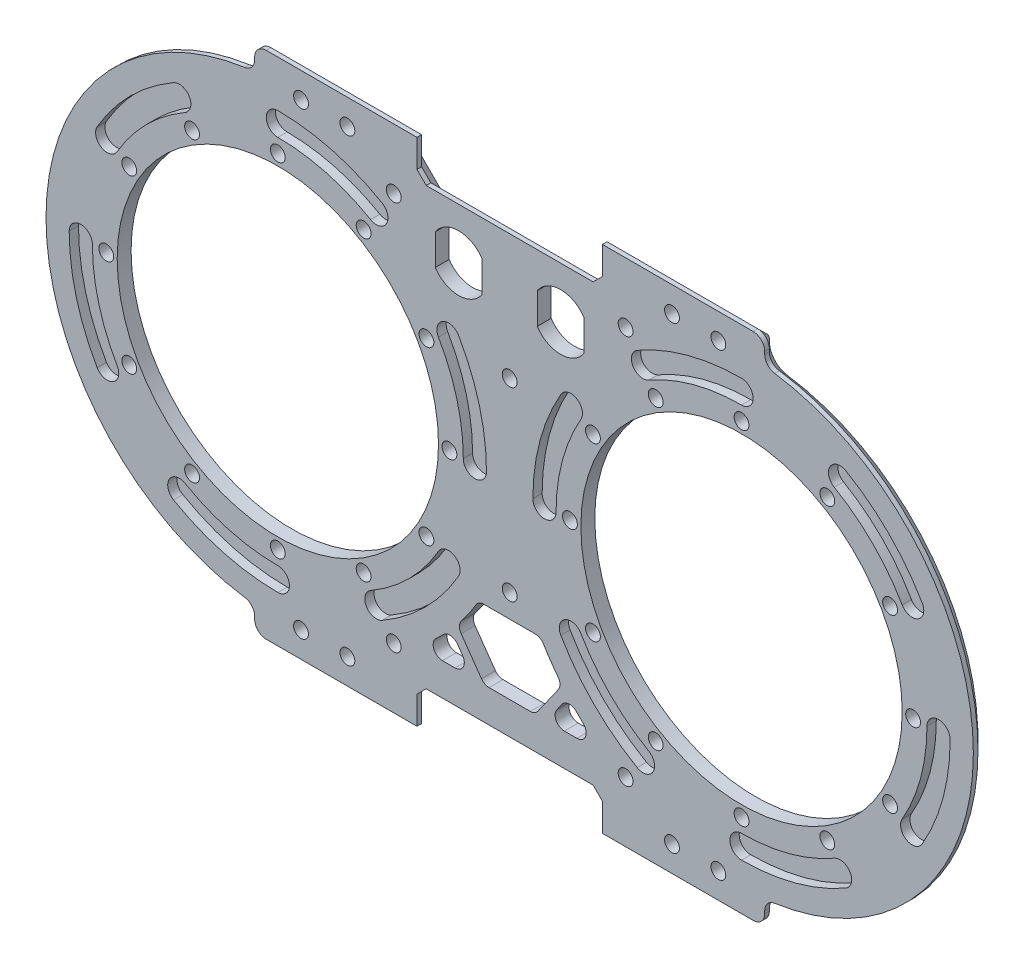
from build123d import *

# Parameters (mm, degrees)
SKETCH_1_R           = 34.65
SKETCH_1_R_2         = 1.6
EXTRUDE_1_DEPTH      = 3
FILLET_1_R           = 2.5
CUT_EXTRUDE_1_DEPTH  = 2
CUT_EXTRUDE_START    = -10
CUT_EXTRUDE_2_DEPTH  = 10
FILLET_2_R           = 2
CUT_EXTRUDE_8_DEPTH  = 3
SKETCH_15_R          = 1.6
CUT_EXTRUDE_9_DEPTH  = 10
SKETCH_16_W          = 40
SKETCH_16_H          = 8
CUT_EXTRUDE_10_DEPTH = 10
CHAMFER_1_SIZE       = 2
SKETCH_17_R          = 1.6
CUT_EXTRUDE_11_DEPTH = 10


# Read off the part's stored shape, not the designer's step: 切除-拉伸8
with BuildPart() as part:
    # 草图1 → 凸台-拉伸1 (new body)
    with BuildSketch(Plane.XY):
        with BuildLine():
            Line((55, 55), (55, 49.749371855))
            ThreePointArc((55, 49.749371855), (100, 0), (55, -49.749371855))
            Line((55, -49.749371855), (55, -55))
            Line((55, -55), (-55, -55))
            Line((-55, -55), (-55, -49.749371855))
            ThreePointArc((-55, -49.749371855), (-100, 0), (-55, 49.749371855))
            Line((-55, 49.749371855), (-55, 55))
            Line((-55, 55), (55, 55))
        make_face()
        with Locations((-50, 0)):
            Circle(SKETCH_1_R, mode=Mode.SUBTRACT)
        with Locations(Location((50, 0, 0), (0, 0, 180))):
            Circle(SKETCH_1_R, mode=Mode.SUBTRACT)
        with Locations((-50, 37)):
            Circle(SKETCH_1_R_2, mode=Mode.SUBTRACT)
        with Locations((-31.5, 32.04293994)):
            Circle(SKETCH_1_R_2, mode=Mode.SUBTRACT)
        with Locations((-17.95706006, 18.5)):
            Circle(SKETCH_1_R_2, mode=Mode.SUBTRACT)
        with Locations((-13, 0)):
            Circle(SKETCH_1_R_2, mode=Mode.SUBTRACT)
        with Locations((-17.95706006, -18.5)):
            Circle(SKETCH_1_R_2, mode=Mode.SUBTRACT)
        with Locations((-31.5, -32.04293994)):
            Circle(SKETCH_1_R_2, mode=Mode.SUBTRACT)
        with Locations((-50, -37)):
            Circle(SKETCH_1_R_2, mode=Mode.SUBTRACT)
        with Locations((-68.5, -32.04293994)):
            Circle(SKETCH_1_R_2, mode=Mode.SUBTRACT)
        with Locations((-82.04293994, -18.5)):
            Circle(SKETCH_1_R_2, mode=Mode.SUBTRACT)
        with Locations((-87, 0)):
            Circle(SKETCH_1_R_2, mode=Mode.SUBTRACT)
        with Locations((-82.04293994, 18.5)):
            Circle(SKETCH_1_R_2, mode=Mode.SUBTRACT)
        with Locations((-68.5, 32.04293994)):
            Circle(SKETCH_1_R_2, mode=Mode.SUBTRACT)
        with Locations(Location((68.5, 32.04293994, 0), (0, 0, 180))):
            Circle(SKETCH_1_R_2, mode=Mode.SUBTRACT)
        with Locations(Location((50, 37, 0), (0, 0, 180))):
            Circle(SKETCH_1_R_2, mode=Mode.SUBTRACT)
        with Locations(Location((31.5, 32.04293994, 0), (0, 0, 180))):
            Circle(SKETCH_1_R_2, mode=Mode.SUBTRACT)
        with Locations(Location((17.95706006, 18.5, 0), (0, 0, 180))):
            Circle(SKETCH_1_R_2, mode=Mode.SUBTRACT)
        with Locations(Location((13, 0, 0), (0, 0, 180))):
            Circle(SKETCH_1_R_2, mode=Mode.SUBTRACT)
        with Locations(Location((17.95706006, -18.5, 0), (0, 0, 180))):
            Circle(SKETCH_1_R_2, mode=Mode.SUBTRACT)
        with Locations(Location((31.5, -32.04293994, 0), (0, 0, 180))):
            Circle(SKETCH_1_R_2, mode=Mode.SUBTRACT)
        with Locations(Location((50, -37, 0), (0, 0, 180))):
            Circle(SKETCH_1_R_2, mode=Mode.SUBTRACT)
        with Locations(Location((68.5, -32.04293994, 0), (0, 0, 180))):
            Circle(SKETCH_1_R_2, mode=Mode.SUBTRACT)
        with Locations(Location((82.04293994, -18.5, 0), (0, 0, 180))):
            Circle(SKETCH_1_R_2, mode=Mode.SUBTRACT)
        with Locations(Location((87, 0, 0), (0, 0, 180))):
            Circle(SKETCH_1_R_2, mode=Mode.SUBTRACT)
        with Locations(Location((82.04293994, 18.5, 0), (0, 0, 180))):
            Circle(SKETCH_1_R_2, mode=Mode.SUBTRACT)
    extrude(amount=EXTRUDE_1_DEPTH)

    # 圆角1
    fillet_1_edges = [part.edges().sort_by_distance(p)[0] for p in [
        (55, 55, 1.5),
        (55, 49.749371855, 1.5),
        (55, -49.749371855, 1.5),
        (55, -55, 1.5),
        (-55, -55, 1.5),
        (-55, -49.749371855, 1.5),
        (-55, 49.749371855, 1.5),
        (-55, 55, 1.5),
    ]]
    fillet(fillet_1_edges, radius=FILLET_1_R)

    # 草图2 → 切除-拉伸1 (cut)
    with BuildSketch(Plane.XY.offset(3)):
        with BuildLine():
            ThreePointArc((95, 0), (93.466662183, -11.64685703), (88.97114317, -22.5))
            ThreePointArc((88.97114317, -22.5), (85.556079661, -23.415063509), (84.641016151, -20))
            ThreePointArc((84.641016151, -20), (88.637033052, -10.352761804), (90, 0))
            ThreePointArc((90, 0), (92.5, 2.5), (95, 0))
        make_face()
        with BuildLine():
            ThreePointArc((72.5, -38.97114317), (61.64685703, -43.466662183), (50, -45))
            ThreePointArc((50, -45), (47.5, -42.5), (50, -40))
            ThreePointArc((50, -40), (60.352761804, -38.637033052), (70, -34.641016151))
            ThreePointArc((70, -34.641016151), (73.415063509, -35.556079661), (72.5, -38.97114317))
        make_face()
        with BuildLine():
            ThreePointArc((27.5, -38.97114317), (18.180194847, -31.819805153), (11.02885683, -22.5))
            ThreePointArc((11.02885683, -22.5), (11.943920339, -19.084936491), (15.358983849, -20))
            ThreePointArc((15.358983849, -20), (21.715728753, -28.284271247), (30, -34.641016151))
            ThreePointArc((30, -34.641016151), (30.915063509, -38.056079661), (27.5, -38.97114317))
        make_face()
        with BuildLine():
            ThreePointArc((5, 0), (6.533337817, 11.64685703), (11.02885683, 22.5))
            ThreePointArc((11.02885683, 22.5), (14.443920339, 23.415063509), (15.358983849, 20))
            ThreePointArc((15.358983849, 20), (11.362966948, 10.352761804), (10, 0))
            ThreePointArc((10, 0), (7.5, -2.5), (5, 0))
        make_face()
        with BuildLine():
            ThreePointArc((27.5, 38.97114317), (38.35314297, 43.466662183), (50, 45))
            ThreePointArc((50, 45), (52.5, 42.5), (50, 40))
            ThreePointArc((50, 40), (39.647238196, 38.637033052), (30, 34.641016151))
            ThreePointArc((30, 34.641016151), (26.584936491, 35.556079661), (27.5, 38.97114317))
        make_face()
        with BuildLine():
            ThreePointArc((72.5, 38.97114317), (81.819805153, 31.819805153), (88.97114317, 22.5))
            ThreePointArc((88.97114317, 22.5), (88.056079661, 19.084936491), (84.641016151, 20))
            ThreePointArc((84.641016151, 20), (78.284271247, 28.284271247), (70, 34.641016151))
            ThreePointArc((70, 34.641016151), (69.084936491, 38.056079661), (72.5, 38.97114317))
        make_face()
        with BuildLine():
            ThreePointArc((-70, 34.641016151), (-78.284271247, 28.284271247), (-84.641016151, 20))
            ThreePointArc((-84.641016151, 20), (-88.056079661, 19.084936491), (-88.97114317, 22.5))
            ThreePointArc((-88.97114317, 22.5), (-81.819805153, 31.819805153), (-72.5, 38.97114317))
            ThreePointArc((-72.5, 38.97114317), (-69.084936491, 38.056079661), (-70, 34.641016151))
        make_face()
        with BuildLine():
            ThreePointArc((-30, 34.641016151), (-39.647238196, 38.637033052), (-50, 40))
            ThreePointArc((-50, 40), (-52.5, 42.5), (-50, 45))
            ThreePointArc((-50, 45), (-38.35314297, 43.466662183), (-27.5, 38.97114317))
            ThreePointArc((-27.5, 38.97114317), (-26.584936491, 35.556079661), (-30, 34.641016151))
        make_face()
        with BuildLine():
            ThreePointArc((-10, 0), (-11.362966948, 10.352761804), (-15.358983849, 20))
            ThreePointArc((-15.358983849, 20), (-14.443920339, 23.415063509), (-11.02885683, 22.5))
            ThreePointArc((-11.02885683, 22.5), (-6.533337817, 11.64685703), (-5, 0))
            ThreePointArc((-5, 0), (-7.5, -2.5), (-10, 0))
        make_face()
        with BuildLine():
            ThreePointArc((-30, -34.641016151), (-21.715728753, -28.284271247), (-15.358983849, -20))
            ThreePointArc((-15.358983849, -20), (-11.943920339, -19.084936491), (-11.02885683, -22.5))
            ThreePointArc((-11.02885683, -22.5), (-18.180194847, -31.819805153), (-27.5, -38.97114317))
            ThreePointArc((-27.5, -38.97114317), (-30.915063509, -38.056079661), (-30, -34.641016151))
        make_face()
        with BuildLine():
            ThreePointArc((-70, -34.641016151), (-60.352761804, -38.637033052), (-50, -40))
            ThreePointArc((-50, -40), (-47.5, -42.5), (-50, -45))
            ThreePointArc((-50, -45), (-61.64685703, -43.466662183), (-72.5, -38.97114317))
            ThreePointArc((-72.5, -38.97114317), (-73.415063509, -35.556079661), (-70, -34.641016151))
        make_face()
        with BuildLine():
            ThreePointArc((-90, 0), (-88.637033052, -10.352761804), (-84.641016151, -20))
            ThreePointArc((-84.641016151, -20), (-85.556079661, -23.415063509), (-88.97114317, -22.5))
            ThreePointArc((-88.97114317, -22.5), (-93.466662183, -11.64685703), (-95, 0))
            ThreePointArc((-95, 0), (-92.5, 2.5), (-90, 0))
        make_face()
    extrude(amount=-CUT_EXTRUDE_1_DEPTH, mode=Mode.SUBTRACT)

    # 草图3 → 切除-拉伸2 (cut)
    with BuildSketch(Plane.XY.offset(3).offset(CUT_EXTRUDE_START)):
        with BuildLine():
            Line((-12.68004397, -33.274928729), (-7.923571604, -40))
            Line((-7.923571604, -40), (-20, -40))
            ThreePointArc((-20, -40), (-16.172485077, -36.819821213), (-12.68004397, -33.274928729))
        make_face()
        with BuildLine():
            Line((6.698729811, -25), (-6.698729811, -25))
            ThreePointArc((-6.698729811, -25), (-8.881983628, -28.448351967), (-11.339210547, -31.707149965))
            Line((-11.339210547, -31.707149965), (-5.473888018, -40))
            Line((-5.473888018, -40), (5.473888018, -40))
            Line((5.473888018, -40), (11.339210547, -31.707149965))
            ThreePointArc((11.339210547, -31.707149965), (8.881983628, -28.448351967), (6.698729811, -25))
        make_face()
        with BuildLine():
            Line((7.923571604, -40), (20, -40))
            ThreePointArc((20, -40), (16.172485077, -36.819821213), (12.68004397, -33.274928729))
            Line((12.68004397, -33.274928729), (7.923571604, -40))
        make_face()
    extrude(amount=CUT_EXTRUDE_2_DEPTH, mode=Mode.SUBTRACT)

    # 圆角2
    fillet_2_edges = [part.edges().sort_by_distance(p)[0] for p in [
        (-5.473888018, -40, 1.5),
        (-11.339210547, -31.707149965, 1.5),
        (-6.698729811, -25, 1.5),
        (6.698729811, -25, 1.5),
        (11.339210547, -31.707149965, 1.5),
        (5.473888018, -40, 1.5),
        (12.68004397, -33.274928729, 1.5),
        (20, -40, 1.5),
        (7.923571604, -40, 1.5),
        (-20, -40, 1.5),
        (-12.68004397, -33.274928729, 1.5),
        (-7.923571604, -40, 1.5),
    ]]
    fillet(fillet_2_edges, radius=FILLET_2_R)

    # 切除-拉伸8 outline → 切除-拉伸8 (cut)
    with BuildSketch(Plane.XY):
        with BuildLine():
            Line((16.05, 32.66833375), (16.05, 39.33166625))
            ThreePointArc((16.05, 39.33166625), (11, 42.05), (5.95, 39.33166625))
            Line((5.95, 39.33166625), (5.95, 32.66833375))
            ThreePointArc((5.95, 32.66833375), (11, 29.95), (16.05, 32.66833375))
        make_face()
        with BuildLine():
            Line((-5.95, 32.66833375), (-5.95, 39.33166625))
            ThreePointArc((-5.95, 39.33166625), (-11, 42.05), (-16.05, 39.33166625))
            Line((-16.05, 39.33166625), (-16.05, 32.66833375))
            ThreePointArc((-16.05, 32.66833375), (-11, 29.95), (-5.95, 32.66833375))
        make_face()
    extrude(amount=CUT_EXTRUDE_8_DEPTH, mode=Mode.SUBTRACT)

    # 草图15 → 切除-拉伸9 (cut)
    with BuildSketch(Plane(origin=(0, 0, 0), x_dir=(-1, 0, 0), z_dir=(0, 0, -1))):
        with Locations((45, 49.5)):
            Circle(SKETCH_15_R)
        with Locations((35, 49.5)):
            Circle(SKETCH_15_R)
        with Locations(Location((35, -49.5, 0), (0, 0, 180))):
            Circle(SKETCH_15_R)
        with Locations(Location((45, -49.5, 0), (0, 0, 180))):
            Circle(SKETCH_15_R)
        with Locations((-45, -49.5)):
            Circle(SKETCH_15_R)
        with Locations((-35, -49.5)):
            Circle(SKETCH_15_R)
        with Locations(Location((-35, 49.5, 0), (0, 0, 180))):
            Circle(SKETCH_15_R)
        with Locations(Location((-45, 49.5, 0), (0, 0, 180))):
            Circle(SKETCH_15_R)
    extrude(amount=-CUT_EXTRUDE_9_DEPTH, mode=Mode.SUBTRACT)

    # 草图16 → 切除-拉伸10 (cut)
    with BuildSketch(Plane(origin=(0, 0, 0), x_dir=(-1, 0, 0), z_dir=(0, 0, -1))):
        with Locations((0, 51)):
            Rectangle(SKETCH_16_W, SKETCH_16_H)
        with Locations((0, -51)):
            Rectangle(SKETCH_16_W, SKETCH_16_H)
    extrude(amount=-CUT_EXTRUDE_10_DEPTH, mode=Mode.SUBTRACT)

    # 倒角1
    chamfer_1_edges = [part.edges().sort_by_distance(p)[0] for p in [
        (-55, 52.230762114, 0),
        (36.25, 55, 0),
        (55, 52.230762114, 0),
        (100, 0, 0),
        (55, -52.230762114, 0),
        (-36.25, -55, 0),
        (-55, -52.230762114, 0),
        (-100, 0, 0),
        (54.267766953, 54.267766953, 0),
        (54.267766953, -54.267766953, 0),
        (-54.267766953, -54.267766953, 0),
        (-54.267766953, 54.267766953, 0),
        (-55.610177635, 50.32489005, 0),
        (-55.610177635, -50.32489005, 0),
        (55.610177635, -50.32489005, 0),
        (55.610177635, 50.32489005, 0),
        (36.25, -55, 0),
        (-36.25, 55, 0),
        (-20, 47, 1.5),
        (20, 47, 1.5),
        (-20, 51, 0),
        (20, 51, 0),
        (0, 47, 0),
        (20, -47, 1.5),
        (-20, -47, 1.5),
        (0, -47, 0),
        (20, -51, 0),
        (-20, -51, 0),
    ]]
    chamfer(chamfer_1_edges, length=CHAMFER_1_SIZE)

    # 草图17 → 切除-拉伸11 (cut)
    with BuildSketch(Plane(origin=(0, 0, 0), x_dir=(-1, 0, 0), z_dir=(0, 0, -1))):
        with Locations((25, 42)):
            Circle(SKETCH_17_R)
        with Locations((0, 20)):
            Circle(SKETCH_17_R)
        with Locations(Location((-25, 42, 0), (0, 0, 180))):
            Circle(SKETCH_17_R)
        with Locations((-25, -42)):
            Circle(SKETCH_17_R)
        with Locations(Location((0, -20, 0), (0, 0, 180))):
            Circle(SKETCH_17_R)
        with Locations(Location((25, -42, 0), (0, 0, 180))):
            Circle(SKETCH_17_R)
    extrude(amount=-CUT_EXTRUDE_11_DEPTH, mode=Mode.SUBTRACT)


solid = part.part
